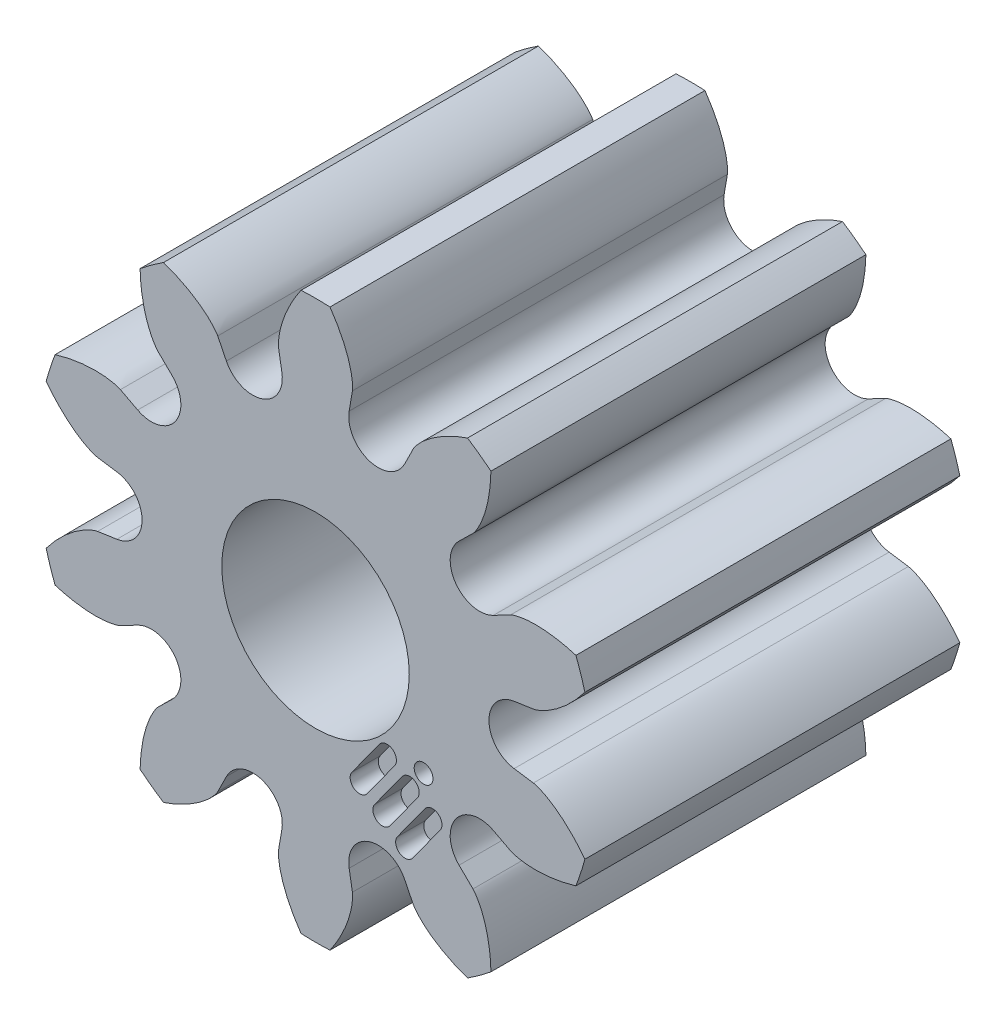
from build123d import *

# Parameters (mm, degrees)
SKETCH2_R                = 2.975
BOSS_EXTRUDE1_DEPTH      = 4
CUT_EXTRUDE2_DEPTH       = 6.805277771
CIRPATTERN1_COUNT        = 10
SKETCH3_R                = 1
CUT_EXTRUDE3_DEPTH       = 6.753809153
S3LOCATIONCUT_DEPTH      = 6.753809153
S3LOCATIONCUT_DEPTH_BACK = 6.753809153
SKETCH6_R                = 0.1
CUT_EXTRUDE6_DEPTH       = 0.3


with BuildPart() as part:
    # Sketch2 → Boss-Extrude1 (new body)
    with BuildSketch(Plane.XY):
        Circle(SKETCH2_R)
    extrude(amount=BOSS_EXTRUDE1_DEPTH)

    # Sketch1 → Cut-Extrude2 (cut, through all)
    with BuildSketch(Plane.XY):
        with BuildLine():
            Line((2.118802744, 0.311161557), (2.324301091, 0.34134048))
            add(Edge.make_bspline(
                [(2.324301091, 0.34134048), (2.327813072, 0.341921295), (2.334388586, 0.343386718), (2.345030511, 0.346171674), (2.36577924, 0.3526687), (2.388842068, 0.361367632), (2.414449361, 0.372510204), (2.44148436, 0.38578486), (2.464277133, 0.397932627), (2.486695956, 0.410784176), (2.508729871, 0.424242482), (2.535047878, 0.441309077), (2.566075811, 0.462830042), (2.6015212, 0.489491876), (2.640713877, 0.521486063), (2.679513246, 0.555919458), (2.716729074, 0.591287377), (2.753162193, 0.62867505), (2.787580014, 0.666018476), (2.822059593, 0.706430194), (2.85324475, 0.744564876), (2.886712811, 0.789016067), (2.913297644, 0.825399679), (2.939492059, 0.864374442), (2.952052022, 0.883546328), (2.958390562, 0.893428715)],
                knots=[0, 0, 0, 0, 0, 0.015083688, 0.02853182, 0.046610139, 0.092110525, 0.119476176, 0.146842495, 0.174208854, 0.201574955, 0.228941013, 0.256307345, 0.307035032, 0.361767351, 0.41649966, 0.471231936, 0.525964282, 0.580696615, 0.635428982, 0.690161387, 0.744893688, 0.799626082, 0.854358408, 0.909090915, 0.909090915, 0.909090915, 0.909090915, 0.909090915], degree=4))
            ThreePointArc((2.958390562, 0.893428715), (3.090354281, 0), (2.958390562, -0.893428715))
            add(Edge.make_bspline(
                [(2.324301091, -0.34134048), (2.327813072, -0.341921295), (2.334388586, -0.343386718), (2.345030511, -0.346171674), (2.36577924, -0.3526687), (2.388842068, -0.361367632), (2.414449361, -0.372510204), (2.44148436, -0.38578486), (2.464277133, -0.397932627), (2.486695956, -0.410784176), (2.508729871, -0.424242482), (2.535047878, -0.441309077), (2.566075811, -0.462830042), (2.6015212, -0.489491876), (2.640713877, -0.521486063), (2.679513246, -0.555919458), (2.716729074, -0.591287377), (2.753162193, -0.62867505), (2.787580014, -0.666018476), (2.822059593, -0.706430194), (2.85324475, -0.744564876), (2.886712811, -0.789016067), (2.913297644, -0.825399679), (2.939492059, -0.864374442), (2.952052022, -0.883546328), (2.958390562, -0.893428715)],
                knots=[0, 0, 0, 0, 0, 0.015083688, 0.02853182, 0.046610139, 0.092110525, 0.119476176, 0.146842495, 0.174208854, 0.201574955, 0.228941013, 0.256307345, 0.307035032, 0.361767351, 0.41649966, 0.471231936, 0.525964282, 0.580696615, 0.635428982, 0.690161387, 0.744893688, 0.799626082, 0.854358408, 0.909090915, 0.909090915, 0.909090915, 0.909090915, 0.909090915], degree=4))
            Line((2.324301091, -0.34134048), (2.118802744, -0.311161557))
            ThreePointArc((2.118802744, -0.311161557), (1.9265063, -0.205594522), (1.85, 0))
            ThreePointArc((1.85, 0), (1.9265063, 0.205594522), (2.118802744, 0.311161557))
        make_face()
    cut_extrude2 = extrude(amount=CUT_EXTRUDE2_DEPTH, mode=Mode.SUBTRACT)

    # CirPattern1: Cut-Extrude2 ×10 about axis
    cirpattern1_axis = Axis((0, 0, 4.2), (0, 0, -1))
    for i in range(1, CIRPATTERN1_COUNT):
        add(cut_extrude2.rotate(cirpattern1_axis, i * 360 / CIRPATTERN1_COUNT), mode=Mode.SUBTRACT)

    # Sketch3 → Cut-Extrude3 (cut, through all)
    with BuildSketch(Plane.XY):
        Circle(SKETCH3_R)
    extrude(amount=CUT_EXTRUDE3_DEPTH, mode=Mode.SUBTRACT)

    # Sketch6 → S3LocationCut (cut, two sides: drawn at the far end of the back side and taken through both)
    with BuildSketch(Plane.XY.offset(-S3LOCATIONCUT_DEPTH_BACK)):
        with Locations((1.152849217, -0.837593985)):
            Circle(SKETCH6_R)
    extrude(amount=S3LOCATIONCUT_DEPTH + S3LOCATIONCUT_DEPTH_BACK, mode=Mode.SUBTRACT)

    # Sketch9 → Cut-Extrude6 (cut)
    with BuildSketch(Plane.XY.offset(4)):
        with BuildLine():
            Line((0.792911977, -1.503135256), (1.086804603, -1.098626758))
            ThreePointArc((1.086804603, -1.098626758), (1.064681429, -0.958946534), (0.925001204, -0.981069708))
            Line((0.925001204, -0.981069708), (0.631108578, -1.385578205))
            ThreePointArc((0.631108578, -1.385578205), (0.653231753, -1.52525843), (0.792911977, -1.503135256))
        make_face()
        with BuildLine():
            Line((1.035617076, -1.679470831), (1.329509702, -1.274962334))
            ThreePointArc((1.329509702, -1.274962334), (1.307386527, -1.135282109), (1.167706303, -1.157405284))
            Line((1.167706303, -1.157405284), (0.873813677, -1.561913781))
            ThreePointArc((0.873813677, -1.561913781), (0.895936851, -1.701594005), (1.035617076, -1.679470831))
        make_face()
        with BuildLine():
            Line((0.550206879, -1.32679968), (0.844099505, -0.922291183))
            ThreePointArc((0.844099505, -0.922291183), (0.821976331, -0.782610958), (0.682296106, -0.804734132))
            Line((0.682296106, -0.804734132), (0.38840348, -1.209242629))
            ThreePointArc((0.38840348, -1.209242629), (0.410526654, -1.348922854), (0.550206879, -1.32679968))
        make_face()
    extrude(amount=-CUT_EXTRUDE6_DEPTH, mode=Mode.SUBTRACT)


solid = part.part
